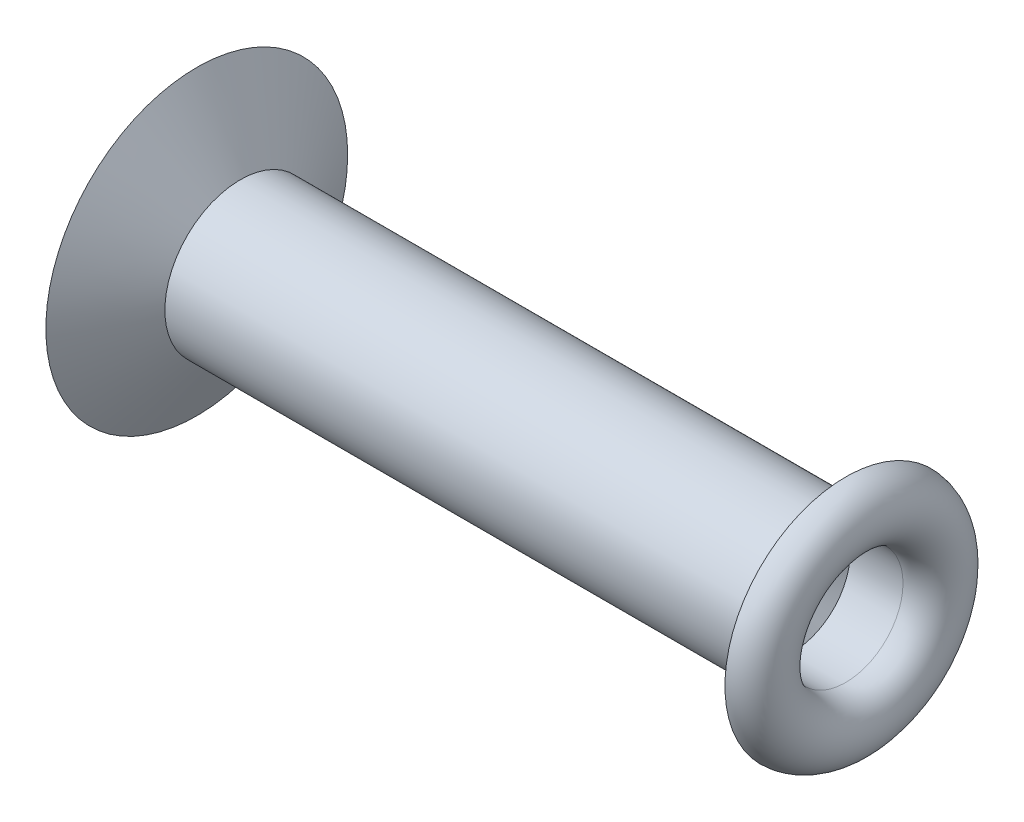
from build123d import *


with BuildPart() as part:
    # Sketch1 → Base-Revolve (revolve)
    with BuildSketch(Plane.XY):
        with BuildLine():
            Line((0, 8), (0, 6.794144144))
            ThreePointArc((0, 6.794144144), (0.796034843, 5.848666431), (-0.1025, 5))
            Line((-0.1025, 5), (-40.113248654, 5))
            Line((-40.113248654, 5), (-43, 10))
            Line((-43, 10), (-43, 0))
            Line((-43, 0), (-5.783270352, 0))
            Line((-5.783270352, 0), (-3.5, 3.8))
            Line((-3.5, 3.8), (0, 3.8))
            ThreePointArc((0, 3.8), (2, 5.9), (0, 8))
        make_face()
    revolve(axis=Axis((40.376928104, 0, 0), (-1, 0, 0)))


solid = part.part
